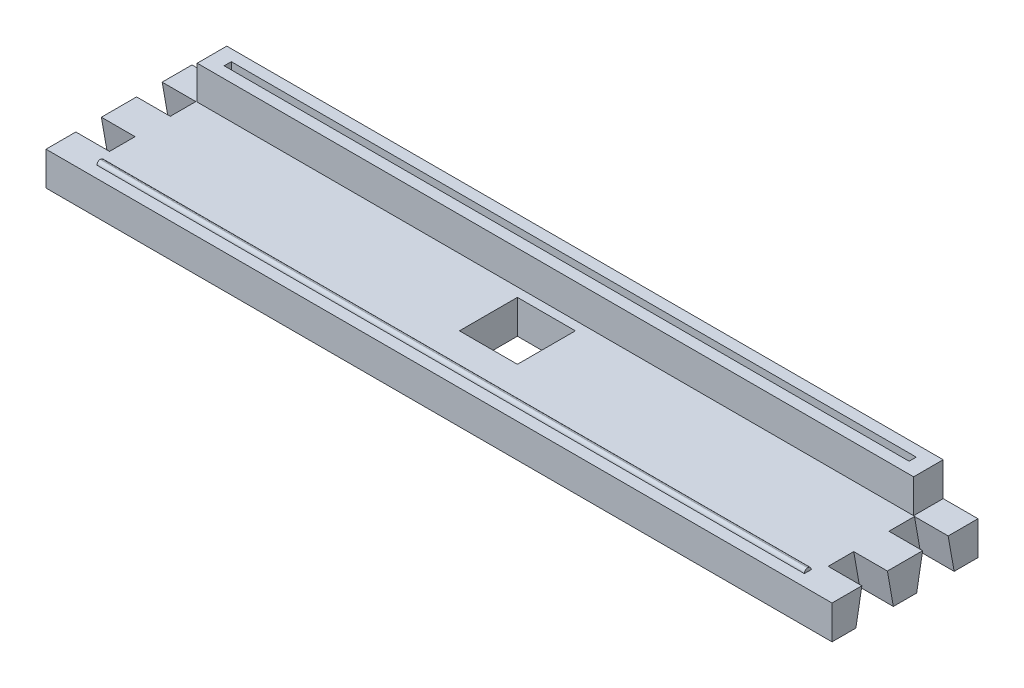
from build123d import *
from OCP.BRepFilletAPI import BRepFilletAPI_MakeChamfer

# Parameters (mm, degrees)
SKETCH2_W           = 51.63
SKETCH2_H           = 51.63
SKETCH2_W_2         = 610
SKETCH2_H_2         = 6.35
BOSS_EXTRUDE1_DEPTH = 30
SKETCH2_4_W         = 630
SKETCH2_4_H         = 6.2
BOSS_EXTRUDE3_DEPTH = 3
FILLET2_R           = 3
CHAMFER1_SIZE       = 30
CHAMFER1_SIZE_2     = 5.289809421
CHAMFER2_SIZE       = 30
CHAMFER2_SIZE_2     = 5.289809421
SKETCH2_7_W         = 638
SKETCH2_7_H         = 26.35
SKETCH2_7_W_2       = 610
SKETCH2_7_H_2       = 6.35
BOSS_EXTRUDE5_DEPTH = 30


with BuildPart() as part:
    # Sketch2 → Boss-Extrude1 (new body)
    with BuildSketch(Plane(origin=(0, 0, 0), x_dir=(1, 0, 0), z_dir=(0, 1, 0))):
        Polygon((-350, -38.442), (-350, -65), (350, -65), (350, -38.442), (320, -38.442), (320, -15.674), (350, -15.674), (350, 15.674), (320, 15.674), (320, 38.442), (350, 38.442), (350, 65), (-350, 65), (-350, 38.442), (-320, 38.442), (-320, 15.674), (-350, 15.674), (-350, -15.674), (-320, -15.674), (-320, -38.442), align=None)
        with Locations((0, 4.815)):
            Rectangle(SKETCH2_W, SKETCH2_H, mode=Mode.SUBTRACT)
        with Locations((0, 51.825)):
            Rectangle(SKETCH2_W_2, SKETCH2_H_2, mode=Mode.SUBTRACT)
    extrude(amount=-BOSS_EXTRUDE1_DEPTH)

    # Sketch2<4> → Boss-Extrude3 (add)
    with BuildSketch(Plane(origin=(0, 0, 0), x_dir=(1, 0, 0), z_dir=(0, 1, 0))):
        with Locations((0, -51.56)):
            Rectangle(SKETCH2_4_W, SKETCH2_4_H)
    extrude(amount=BOSS_EXTRUDE3_DEPTH)

    # Fillet2
    fillet2_edges = [part.edges().sort_by_distance(p)[0] for p in [
        (0, 3, 48.46),
        (0, 3, 54.66),
    ]]
    fillet(fillet2_edges, radius=FILLET2_R - 0.0001)  # a hair under: the kernel refuses the full size

    # Chamfer1
    chamfer1_edges_1 = [part.edges().sort_by_distance(p)[0] for p in [
        (-335, -30, 15.674),
    ]]
    chamfer1_side_1 = [part.faces().sort_by_distance(p)[0] for p in [
        (-335, -29.894203812, 15.674),
    ]]
    chamfer1_edges_2 = [part.edges().sort_by_distance(p)[0] for p in [
        (-335, -30, -38.442),
    ]]
    chamfer1_side_2 = [part.faces().sort_by_distance(p)[0] for p in [
        (-335, -29.894203812, -38.442),
    ]]
    chamfer1_edges_3 = [part.edges().sort_by_distance(p)[0] for p in [
        (335, -30, -15.674),
    ]]
    chamfer1_side_3 = [part.faces().sort_by_distance(p)[0] for p in [
        (335, -29.894203812, -15.674),
    ]]
    chamfer1_edges_4 = [part.edges().sort_by_distance(p)[0] for p in [
        (335, -30, 38.442),
    ]]
    chamfer1_side_4 = [part.faces().sort_by_distance(p)[0] for p in [
        (335, -29.894203812, 38.442),
    ]]
    chamfer1 = BRepFilletAPI_MakeChamfer(part.part.solid().wrapped)
    for e in chamfer1_edges_1:
        chamfer1.Add(CHAMFER1_SIZE - 0.0001, CHAMFER1_SIZE_2 - 0.0001, e.wrapped, chamfer1_side_1[0].wrapped)
    for e in chamfer1_edges_2:
        chamfer1.Add(CHAMFER1_SIZE - 0.0001, CHAMFER1_SIZE_2 - 0.0001, e.wrapped, chamfer1_side_2[0].wrapped)
    for e in chamfer1_edges_3:
        chamfer1.Add(CHAMFER1_SIZE - 0.0001, CHAMFER1_SIZE_2 - 0.0001, e.wrapped, chamfer1_side_3[0].wrapped)
    for e in chamfer1_edges_4:
        chamfer1.Add(CHAMFER1_SIZE - 0.0001, CHAMFER1_SIZE_2 - 0.0001, e.wrapped, chamfer1_side_4[0].wrapped)
    add(Compound.cast(chamfer1.Shape()), mode=Mode.REPLACE)  # a hair under: the kernel refuses the full size

    # Chamfer2
    chamfer2_edges_1 = [part.edges().sort_by_distance(p)[0] for p in [
        (-335, -30, 38.442),
    ]]
    chamfer2_side_1 = [part.faces().sort_by_distance(p)[0] for p in [
        (-335, -29.894203812, 38.442),
    ]]
    chamfer2_edges_2 = [part.edges().sort_by_distance(p)[0] for p in [
        (-335, -30, -15.674),
    ]]
    chamfer2_side_2 = [part.faces().sort_by_distance(p)[0] for p in [
        (-335, -29.894203812, -15.674),
    ]]
    chamfer2_edges_3 = [part.edges().sort_by_distance(p)[0] for p in [
        (335, -30, -38.442),
    ]]
    chamfer2_side_3 = [part.faces().sort_by_distance(p)[0] for p in [
        (335, -29.894203812, -38.442),
    ]]
    chamfer2_edges_4 = [part.edges().sort_by_distance(p)[0] for p in [
        (335, -30, 15.674),
    ]]
    chamfer2_side_4 = [part.faces().sort_by_distance(p)[0] for p in [
        (335, -29.894203812, 15.674),
    ]]
    chamfer2 = BRepFilletAPI_MakeChamfer(part.part.solid().wrapped)
    for e in chamfer2_edges_1:
        chamfer2.Add(CHAMFER2_SIZE - 0.0001, CHAMFER2_SIZE_2 - 0.0001, e.wrapped, chamfer2_side_1[0].wrapped)
    for e in chamfer2_edges_2:
        chamfer2.Add(CHAMFER2_SIZE - 0.0001, CHAMFER2_SIZE_2 - 0.0001, e.wrapped, chamfer2_side_2[0].wrapped)
    for e in chamfer2_edges_3:
        chamfer2.Add(CHAMFER2_SIZE - 0.0001, CHAMFER2_SIZE_2 - 0.0001, e.wrapped, chamfer2_side_3[0].wrapped)
    for e in chamfer2_edges_4:
        chamfer2.Add(CHAMFER2_SIZE - 0.0001, CHAMFER2_SIZE_2 - 0.0001, e.wrapped, chamfer2_side_4[0].wrapped)
    add(Compound.cast(chamfer2.Shape()), mode=Mode.REPLACE)  # a hair under: the kernel refuses the full size

    # Sketch2<7> → Boss-Extrude5 (add)
    with BuildSketch(Plane(origin=(0, 0, 0), x_dir=(1, 0, 0), z_dir=(0, 1, 0))):
        with Locations((0, 51.825)):
            Rectangle(SKETCH2_7_W, SKETCH2_7_H)
        with Locations((0, 51.825)):
            Rectangle(SKETCH2_7_W_2, SKETCH2_7_H_2, mode=Mode.SUBTRACT)
    extrude(amount=BOSS_EXTRUDE5_DEPTH)


solid = part.part
